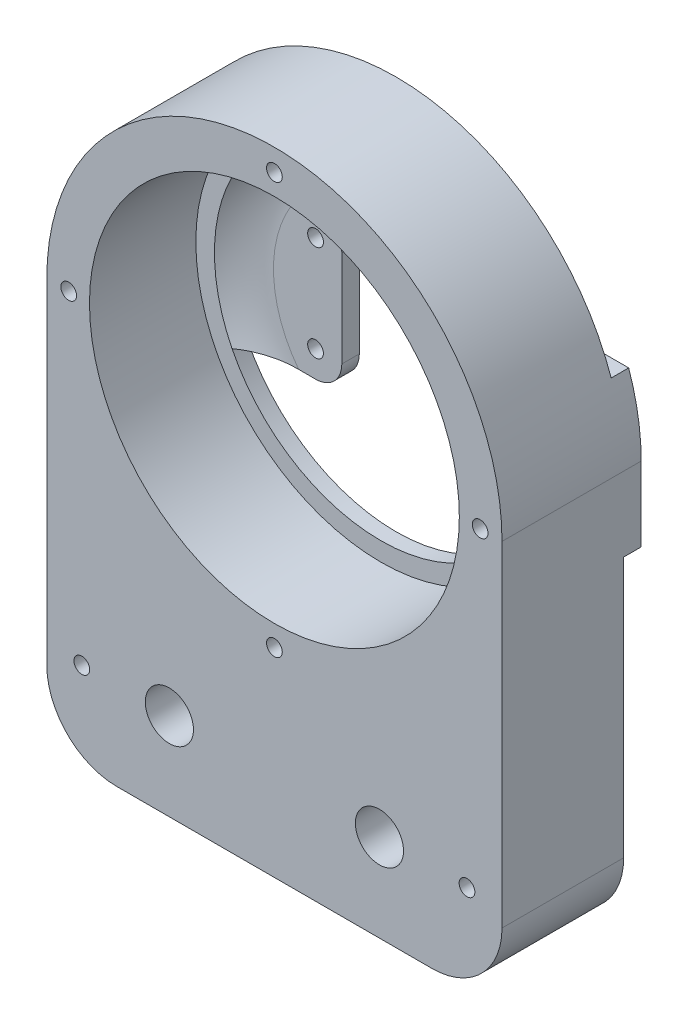
from build123d import *

# Parameters (mm, degrees)
SKETCH_2_R          = 19
SKETCH_2_R_2        = 2.75
EXTRUDE_1_DEPTH     = 13.9
SKETCH_3_R          = 21.125
CUT_EXTRUDE_1_DEPTH = 12.15
SKETCH_4_R          = 5
CUT_EXTRUDE_2_DEPTH = 8.9
FILLET_1_R          = 8
EXTRUDE_START       = 2
SKETCH_7_R          = 0.9
EXTRUDE_2_DEPTH     = 2
SKETCH_5_R          = 0.9
CUT_EXTRUDE_3_DEPTH = 61.488614631
FILLET_2_R          = 8


with BuildPart() as part:
    # Эскиз2 → Бобышка-Вытянуть1 (new body)
    with BuildSketch(Plane.XY):
        with BuildLine():
            ThreePointArc((26, 26.25), (0, 52.25), (-26, 26.25))
            Line((-26, 26.25), (-26, -20))
            Line((-26, -20), (26, -20))
            Line((26, -20), (26, 26.25))
        make_face()
        with Locations((0, 26.25)):
            Circle(SKETCH_2_R, mode=Mode.SUBTRACT)
        with Locations((12, -10)):
            Circle(SKETCH_2_R_2, mode=Mode.SUBTRACT)
        with Locations((-12, -10)):
            Circle(SKETCH_2_R_2, mode=Mode.SUBTRACT)
    extrude(amount=EXTRUDE_1_DEPTH)

    # Эскиз3 → Вырез-Вытянуть1 (cut)
    with BuildSketch(Plane.XY.offset(13.9)):
        with Locations((0, 26.25)):
            Circle(SKETCH_3_R)
    extrude(amount=-CUT_EXTRUDE_1_DEPTH, mode=Mode.SUBTRACT)

    # Эскиз4 → Вырез-Вытянуть2 (cut)
    with BuildSketch(Plane(origin=(0, 0, 0), x_dir=(-1, 0, 0), z_dir=(0, 0, -1))):
        with Locations((-12, -10)):
            Circle(SKETCH_4_R)
        with Locations((12, -10)):
            Circle(SKETCH_4_R)
    extrude(amount=-CUT_EXTRUDE_2_DEPTH, mode=Mode.SUBTRACT)

    # Скругление1
    fillet_1_edges = [part.edges().sort_by_distance(p)[0] for p in [
        (26, -20, 6.95),
        (-26, -20, 6.95),
    ]]
    fillet(fillet_1_edges, radius=FILLET_1_R)

    # Эскиз7 → Бобышка-Вытянуть2 (add)
    # profile 1 of 2: a face of its own
    with BuildSketch(Plane(origin=(0, 0, 0), x_dir=(-1, 0, 0), z_dir=(0, 0, -1)).offset(EXTRUDE_START)):
        with BuildLine():
            Line((-24.571324751, 34.75), (-9.2, 34.75))
            ThreePointArc((-9.2, 34.75), (-7.078679656, 33.871320344), (-6.2, 31.75))
            Line((-6.2, 31.75), (-6.2, 20.75))
            ThreePointArc((-6.2, 20.75), (-7.078679656, 18.628679656), (-9.2, 17.75))
            Line((-9.2, 17.75), (-26, 17.75))
            Line((-26, 17.75), (-26, 26.25))
            ThreePointArc((-26, 26.25), (-25.640343636, 30.559614628), (-24.571324751, 34.75))
        make_face()
        with Locations((-9.2, 31.75)):
            Circle(SKETCH_7_R, mode=Mode.SUBTRACT)
        with Locations((-9.2, 20.75)):
            Circle(SKETCH_7_R, mode=Mode.SUBTRACT)
    # profile 2 of 2: a face of its own
    with BuildSketch(Plane(origin=(0, 0, 0), x_dir=(-1, 0, 0), z_dir=(0, 0, -1)).offset(EXTRUDE_START)):
        with BuildLine():
            Line((26, 26.25), (26, 17.75))
            Line((26, 17.75), (9.2, 17.75))
            ThreePointArc((9.2, 17.75), (7.078679656, 18.628679656), (6.2, 20.75))
            Line((6.2, 20.75), (6.2, 31.75))
            ThreePointArc((6.2, 31.75), (7.078679656, 33.871320344), (9.2, 34.75))
            Line((9.2, 34.75), (24.571324751, 34.75))
            ThreePointArc((24.571324751, 34.75), (25.640343636, 30.559614628), (26, 26.25))
        make_face()
        with Locations(Location((9.2, 20.75, 0), (0, 0, 180))):
            Circle(SKETCH_7_R, mode=Mode.SUBTRACT)
        with Locations(Location((9.2, 31.75, 0), (0, 0, 180))):
            Circle(SKETCH_7_R, mode=Mode.SUBTRACT)
    extrude(amount=-EXTRUDE_2_DEPTH)

    # Эскиз5 → Вырез-Вытянуть3 (cut, through all)
    with BuildSketch(Plane.XY.offset(13.9)):
        with Locations((0, 49.75)):
            Circle(SKETCH_5_R)
        with Locations((-23.5, 26.25)):
            Circle(SKETCH_5_R)
        with Locations((0, 2.75)):
            Circle(SKETCH_5_R)
        with Locations((23.5, 26.25)):
            Circle(SKETCH_5_R)
        with Locations((-22, -10)):
            Circle(SKETCH_5_R)
        with Locations((22, -10)):
            Circle(SKETCH_5_R)
    extrude(amount=-CUT_EXTRUDE_3_DEPTH, mode=Mode.SUBTRACT)

    # Скругление2
    # the kernel refuses this fillet: 8 mm, written as the material it adds along each edge
    with BuildSketch(Plane(origin=(0, 26.25, 0), x_dir=(1, 0, 0), z_dir=(0, -1, 0))) as fillet_2_piece_1_section:
        with BuildLine():
            CenterArc((14.006253911, 8), FILLET_2_R, 270, 38.624832873)
            Line((14.006253911, 0), (19, 0))
            Line((19, 0), (19, 1.75))
        make_face()
    fillet_2_piece_1 = revolve(axis=Axis((0, 26.25, 0), (0, 0, 1)), revolution_arc=64.223731821, mode=Mode.PRIVATE)
    fillet_2_piece_1 = split(fillet_2_piece_1, bisect_by=Plane(origin=(15.779655811, 34.75, 0.435065896), z_dir=(0, -1, 0)), keep=Keep.TOP, mode=Mode.PRIVATE)
    add(fillet_2_piece_1)
    with BuildSketch(Plane(origin=(0, 26.25, 0), x_dir=(-0.43479598917537754, 0.900528982208238, 0), z_dir=(0.900528982208238, 0.43479598917537754, 0))) as fillet_2_piece_2_section:
        with BuildLine():
            CenterArc((14.006253911, 8), FILLET_2_R, 270, 38.624832873)
            Line((14.006253911, 0), (19, 0))
            Line((19, 0), (19, 1.75))
        make_face()
    fillet_2_piece_2 = revolve(axis=Axis((0, 26.25, 0), (0, 0, 1)), revolution_arc=128.45537387, mode=Mode.PRIVATE)
    fillet_2_piece_2 = split(fillet_2_piece_2, bisect_by=Plane(origin=(-16.657296725, 17.75, 0.435065896), z_dir=(0, 1, 0)), keep=Keep.TOP, mode=Mode.PRIVATE)
    fillet_2_piece_2 = split(fillet_2_piece_2, bisect_by=Plane(origin=(-16.657296725, 34.75, 0.435065896), z_dir=(0, -1, 0)), keep=Keep.TOP, mode=Mode.PRIVATE)
    add(fillet_2_piece_2)
    with BuildSketch(Plane(origin=(0, 26.25, 0), x_dir=(0.43485815144729206, -0.9004989661958774, 0), z_dir=(-0.9004989661958774, -0.43485815144729206, 0))) as fillet_2_piece_3_section:
        with BuildLine():
            CenterArc((14.006253911, 8), FILLET_2_R, 270, 38.624832873)
            Line((14.006253911, 0), (19, 0))
            Line((19, 0), (19, 1.75))
        make_face()
    fillet_2_piece_3 = revolve(axis=Axis((0, 26.25, 0), (0, 0, 1)), revolution_arc=64.223731821, mode=Mode.PRIVATE)
    fillet_2_piece_3 = split(fillet_2_piece_3, bisect_by=Plane(origin=(15.779655811, 17.75, 0.435065896), z_dir=(0, 1, 0)), keep=Keep.TOP, mode=Mode.PRIVATE)
    add(fillet_2_piece_3)


solid = part.part
